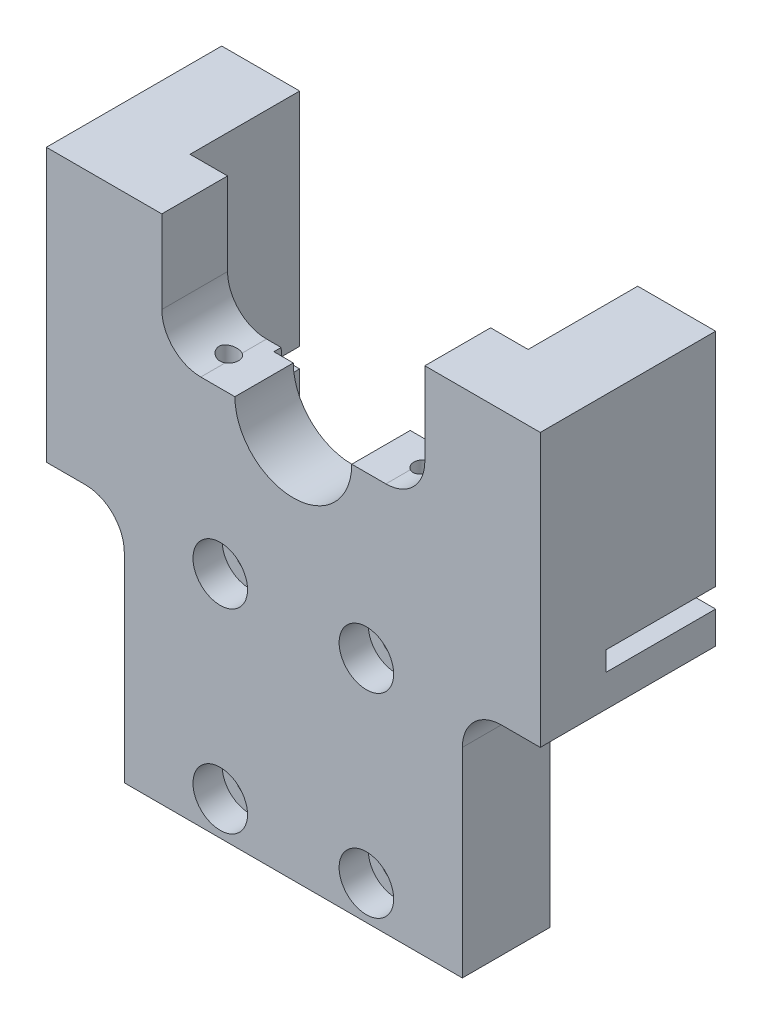
from build123d import *

# Parameters (mm, degrees)
BOSS_EXTRUDE1_DEPTH      = 4.5
SKETCH4_W                = 35.509158229
SKETCH4_H                = 48.512063823
CUT_EXTRUDE2_DEPTH       = 10
SKETCH8_W                = 66
SKETCH8_H                = 9
BOSS_EXTRUDE3_DEPTH      = 5
FILLET7_R                = 10
SKETCH16_R               = 1.5
CUT_EXTRUDE6_DEPTH       = 10
SKETCH17_W               = 15.65
SKETCH17_H               = 52.5
CUT_EXTRUDE7_DEPTH       = 10
SKETCH18_R               = 6
CUT_EXTRUDE8_DEPTH       = 10
SKETCH20_W               = 8
SKETCH20_H               = 28
BOSS_EXTRUDE5_DEPTH      = 18
CUT_EXTRUDE10_DEPTH      = 51.084778127
CUT_EXTRUDE10_DEPTH_BACK = 9
SKETCH23_R               = 8
CUT_EXTRUDE11_DEPTH      = 3
CUT_EXTRUDE12_DEPTH      = 68.0001
CUT_EXTRUDE12_DEPTH_BACK = 8
CUT_EXTRUDE12_START      = -42.7
SKETCH24_W               = 11.249996001
SKETCH24_H               = 2
SKETCH25_R               = 1
CUT_EXTRUDE13_DEPTH      = 12.5
CUT_EXTRUDE15_DEPTH      = 2.25
FILLET8_R                = 4
SKETCH27_W               = 21.7
SKETCH27_H               = 7.5
CUT_EXTRUDE16_DEPTH      = 0.4
CHAMFER1_SIZE            = 0.4
CHAMFER2_SIZE            = 0.4
SKETCH28_R               = 2.8
CUT_EXTRUDE17_DEPTH      = 3
SKETCH29_R               = 2
SKETCH29_W               = 21.7
SKETCH29_H               = 0.8
CUT_EXTRUDE18_DEPTH      = 0.4


# Some blends are built 0.0001 mm under size
with BuildPart() as part:
    # Sketch1 → Boss-Extrude1 (new, symmetric)
    with BuildSketch(Plane.XY):
        Polygon((44.5, -23.75), (-0.5, -23.75), (-44.5, -23.75), (-44.5, 23.75), (44.5, 23.75), align=None)
    extrude(amount=BOSS_EXTRUDE1_DEPTH, both=True)

    # Sketch4 → Cut-Extrude2 (cut)
    with BuildSketch(Plane.XY.offset(4.5)):
        with Locations((39.254579115, -0.506031912)):
            Rectangle(SKETCH4_W, SKETCH4_H)
    extrude(amount=-CUT_EXTRUDE2_DEPTH, mode=Mode.SUBTRACT)

    # Sketch8 → Boss-Extrude3 (add)
    with BuildSketch(Plane(origin=(0, 23.75, 0), x_dir=(1, 0, 0), z_dir=(0, 1, 0))):
        with Locations((-11.5, 0)):
            Rectangle(SKETCH8_W, SKETCH8_H)
    extrude(amount=BOSS_EXTRUDE3_DEPTH)

    # Fillet7
    fillet7_edges = [part.edges().sort_by_distance(p)[0] for p in [
        (-44.5, 28.75, 0),
        (21.5, 28.75, 0),
    ]]
    fillet(fillet7_edges, radius=FILLET7_R)

    # Sketch16 → Cut-Extrude6 (cut)
    with BuildSketch(Plane.XY.offset(4.5)):
        with Locations((-19, -0.25)):
            Circle(SKETCH16_R)
        with Locations((-4, -0.25)):
            Circle(SKETCH16_R)
        with Locations((-19, -20.25)):
            Circle(SKETCH16_R)
        with Locations((-4, -20.25)):
            Circle(SKETCH16_R)
    extrude(amount=-CUT_EXTRUDE6_DEPTH, mode=Mode.SUBTRACT)

    # Sketch17 → Cut-Extrude7 (cut)
    with BuildSketch(Plane(origin=(0, 0, -4.5), x_dir=(-1, 0, 0), z_dir=(0, 0, -1))):
        with Locations((36.675, 2.5)):
            Rectangle(SKETCH17_W, SKETCH17_H)
        with Locations((-13.675, 2.5)):
            Rectangle(SKETCH17_W, SKETCH17_H)
    extrude(amount=-CUT_EXTRUDE7_DEPTH, mode=Mode.SUBTRACT)

    # Sketch18 → Cut-Extrude8 (cut)
    with BuildSketch(Plane.XY.offset(4.5)):
        with Locations((-11.5, 16.25)):
            Circle(SKETCH18_R)
    extrude(amount=-CUT_EXTRUDE8_DEPTH, mode=Mode.SUBTRACT)

    # Sketch20 → Boss-Extrude5 (add)
    with BuildSketch(Plane.XY.offset(4.5)):
        with Locations((-32.85, 14.75)):
            Rectangle(SKETCH20_W, SKETCH20_H)
        with Locations((9.85, 14.75)):
            Rectangle(SKETCH20_W, SKETCH20_H)
    extrude(amount=-BOSS_EXTRUDE5_DEPTH)

    # Sketch22 → Cut-Extrude10 (cut, two sides: drawn at the far end of the back side and taken through both)
    with BuildSketch(Plane.XY.offset(4.5).offset(-CUT_EXTRUDE10_DEPTH_BACK)):
        Polygon((-25, 169.372700937), (-25, 28.75), (-25, 16.25), (2, 16.25), (2, 28.75), (2, 169.372700937), (2, 450.61810281), (-25, 450.61810281), align=None)
    extrude(amount=CUT_EXTRUDE10_DEPTH + CUT_EXTRUDE10_DEPTH_BACK, mode=Mode.SUBTRACT)

    # Sketch23 → Cut-Extrude11 (cut)
    with BuildSketch(Plane(origin=(0, 0, -4.5), x_dir=(-1, 0, 0), z_dir=(0, 0, -1))):
        with Locations((11.5, 16.25)):
            Circle(SKETCH23_R)
    extrude(amount=-CUT_EXTRUDE11_DEPTH, mode=Mode.SUBTRACT)

    # Sketch24 → Cut-Extrude12 (cut, two sides: drawn at the far end of the back side and taken through both)
    with BuildSketch(Plane(origin=(13.85, 0, 0), x_dir=(0, 0, -1), z_dir=(1, 0, 0)).offset(CUT_EXTRUDE12_START - CUT_EXTRUDE12_DEPTH_BACK)):
        with Locations((7.875002, 5.05)):
            Rectangle(SKETCH24_W, SKETCH24_H)
    extrude(amount=CUT_EXTRUDE12_DEPTH + CUT_EXTRUDE12_DEPTH_BACK, mode=Mode.SUBTRACT)

    # Sketch25 → Cut-Extrude13 (cut)
    with BuildSketch(Plane(origin=(0, 16.25, 0), x_dir=(1, 0, 0), z_dir=(0, 1, 0))):
        with Locations(Location((-1.5, -1.125, 0), (0, 0, 180))):
            Circle(SKETCH25_R)
        with Locations(Location((-21.5, -1.125, 0), (0, 0, 180))):
            Circle(SKETCH25_R)
    extrude(amount=-CUT_EXTRUDE13_DEPTH, mode=Mode.SUBTRACT)

    # Sketch26 → Cut-Extrude15 (cut)
    with BuildSketch(Plane(origin=(0, 0, -4.5), x_dir=(-1, 0, 0), z_dir=(0, 0, -1))):
        with BuildLine():
            Line((-5.85, 6.05), (28.85, 6.05))
            Line((28.85, 6.05), (28.85, 28.75))
            Line((28.85, 28.75), (25, 28.75))
            Line((25, 28.75), (25, 16.25))
            Line((25, 16.25), (19.5, 16.25))
            ThreePointArc((19.5, 16.25), (11.5, 8.25), (3.5, 16.25))
            Line((3.5, 16.25), (-2, 16.25))
            Line((-2, 16.25), (-2, 28.75))
            Line((-2, 28.75), (-5.85, 28.75))
            Line((-5.85, 28.75), (-5.85, 6.05))
        make_face()
    extrude(amount=-CUT_EXTRUDE15_DEPTH, mode=Mode.SUBTRACT)

    # Fillet8
    # the kernel refuses this fillet: 4 mm, written as the material it adds along each edge
    with BuildSketch(Plane(origin=(-28.85, 0.75, 4.5), x_dir=(-1, 0, 0), z_dir=(0, 0, -1))) as fillet8_piece_1:
        with BuildLine():
            CenterArc((FILLET8_R, -FILLET8_R), FILLET8_R, 90, 90)
            Line((0, -FILLET8_R), (0, 0))
            Line((0, 0), (FILLET8_R, 0))
        make_face()
    extrude(amount=9)
    with BuildSketch(Plane(origin=(5.85, 0.75, 4.5), x_dir=(1, 0, 0), z_dir=(0, 0, -1))) as fillet8_piece_2:
        with BuildLine():
            CenterArc((FILLET8_R, FILLET8_R), FILLET8_R, 180, 90)
            Line((0, FILLET8_R), (0, 0))
            Line((0, 0), (FILLET8_R, 0))
        make_face()
    extrude(amount=9)
    with BuildSketch(Plane(origin=(2, 16.25, -2.25), x_dir=(-1, 0, 0), z_dir=(0, 0, 1))) as fillet8_piece_3_section:
        with BuildLine():
            CenterArc((FILLET8_R, -FILLET8_R), FILLET8_R, 90, 90)
            Line((0, -FILLET8_R), (0, 0))
            Line((0, 0), (FILLET8_R, 0))
        make_face()
    fillet8_piece_3 = extrude(amount=6.75, mode=Mode.PRIVATE)
    fillet8_piece_3 = fillet8_piece_3 - Plane(origin=(-1.5, 17.15044089, 1.125), x_dir=(-1, 0, 0), z_dir=(0, 1, 0)) * Cylinder(1, 30, mode=Mode.PRIVATE)
    add(fillet8_piece_3)
    with BuildSketch(Plane(origin=(-25, 16.25, -2.25), x_dir=(0, 1, 0), z_dir=(0, 0, 1))) as fillet8_piece_4_section:
        with BuildLine():
            CenterArc((FILLET8_R, -FILLET8_R), FILLET8_R, 90, 90)
            Line((0, -FILLET8_R), (0, 0))
            Line((0, 0), (FILLET8_R, 0))
        make_face()
    fillet8_piece_4 = extrude(amount=6.75, mode=Mode.PRIVATE)
    fillet8_piece_4 = fillet8_piece_4 - Plane(origin=(-21.5, 17.150440868, 1.125), x_dir=(-1, 0, 0), z_dir=(0, 1, 0)) * Cylinder(1, 30, mode=Mode.PRIVATE)
    add(fillet8_piece_4)

    # Sketch27 → Cut-Extrude16 (cut)
    with BuildSketch(Plane(origin=(0, 0, -4.5), x_dir=(-1, 0, 0), z_dir=(0, 0, -1))):
        with Locations((11.5, -20)):
            Rectangle(SKETCH27_W, SKETCH27_H)
        with Locations((11.5, -0.5)):
            Rectangle(SKETCH27_W, SKETCH27_H)
    extrude(amount=-CUT_EXTRUDE16_DEPTH, mode=Mode.SUBTRACT)

    # Chamfer1
    chamfer1_edges = [part.edges().sort_by_distance(p)[0] for p in [
        (-11.5, -4.25, -4.1),
    ]]
    chamfer(chamfer1_edges, length=CHAMFER1_SIZE - 0.0001)  # a hair under: the kernel refuses the full size

    # Chamfer2
    chamfer2_edges = [part.edges().sort_by_distance(p)[0] for p in [
        (-11.5, -16.25, -4.1),
    ]]
    chamfer(chamfer2_edges, length=CHAMFER2_SIZE - 0.0001)  # a hair under: the kernel refuses the full size

    # Sketch28 → Cut-Extrude17 (cut)
    with BuildSketch(Plane.XY.offset(4.5)):
        with Locations((-19, -0.25)):
            Circle(SKETCH28_R)
        with Locations((-4, -0.25)):
            Circle(SKETCH28_R)
        with Locations((-4, -20.25)):
            Circle(SKETCH28_R)
        with Locations((-19, -20.25)):
            Circle(SKETCH28_R)
    extrude(amount=-CUT_EXTRUDE17_DEPTH, mode=Mode.SUBTRACT)

    # Sketch29 → Cut-Extrude18 (cut)
    with BuildSketch(Plane(origin=(0, 0, -4.5), x_dir=(-1, 0, 0), z_dir=(0, 0, -1))):
        with Locations((2.65, -4.25)):
            Circle(SKETCH29_R)
        with Locations((20.35, -4.25)):
            Circle(SKETCH29_R)
        with Locations((2.65, -16.25)):
            Circle(SKETCH29_R)
        with Locations((20.35, -16.25)):
            Circle(SKETCH29_R)
        with Locations((11.5, 3.65)):
            Rectangle(SKETCH29_W, SKETCH29_H)
    extrude(amount=-CUT_EXTRUDE18_DEPTH, mode=Mode.SUBTRACT)


solid = part.part
